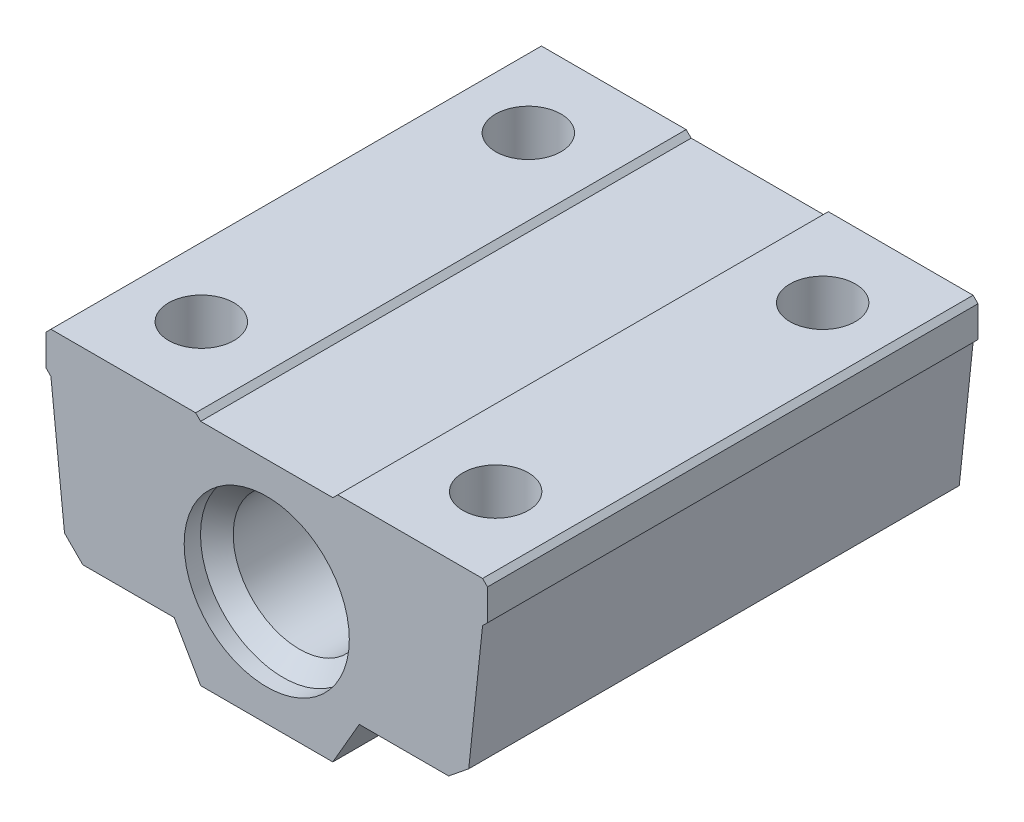
from build123d import *
from OCP.BRepFilletAPI import BRepFilletAPI_MakeChamfer

# Parameters (mm, degrees)
BOSS_EXTRUDE1_DEPTH     = 15
BOSS_EXTRUDE2_DEPTH     = 15
CHAMFER1_SIZE           = 0.3
CHAMFER1_SIZE_2         = 0.303787717
CUT_EXTRUDE1_DEPTH      = 22.460195712
CUT_EXTRUDE1_DEPTH_BACK = 22.460195712
CHAMFER2_SIZE           = 0.3
CHAMFER3_SIZE           = 1
CHAMFER3_SIZE2          = 1.124223602
CUT_EXTRUDE2_DEPTH      = 22.460195712
CUT_EXTRUDE2_DEPTH_BACK = 22.460195712
SKETCH3_R               = 5.05
SKETCH6_R               = 5.05
BOSS_EXTRUDE3_DEPTH     = 14
CUT_EXTRUDE3_DEPTH      = 22.460195712
CUT_EXTRUDE3_DEPTH_BACK = 22.460195712
SKETCH7_R               = 4.05
CHAMFER4_SIZE           = 1
SKETCH8_R               = 2
CUT_EXTRUDE4_DEPTH      = 25.733378257


# Some blends are built 0.0001 mm under size
with BuildPart() as part:
    # Sketch2 → Boss-Extrude1 (new, symmetric)
    with BuildSketch(Plane.XY):
        Polygon((4.041451884, -7), (8.082903769, 0), (4.041451884, 7), (-4.041451884, 7), (-8.082903769, 0), (-4.041451884, -7), align=None)
    extrude(amount=BOSS_EXTRUDE1_DEPTH, both=True)

    # Sketch4 → Boss-Extrude2 (add, symmetric)
    with BuildSketch(Plane.XY):
        Polygon((5.658032638, -4.2), (13.5, -4.2), (13.5, 7.3), (4.045169627, 7.3), (4.041451884, 7), (-4.041451884, 7), (-4.045169627, 7.3), (-13.5, 7.3), (-13.5, -4.2), (-5.658032638, -4.2), (-4.041451884, -7), (4.041451884, -7), align=None)
    extrude(amount=BOSS_EXTRUDE2_DEPTH, both=True)

    # Chamfer1
    # the kernel refuses this chamfer: 0.303787717, 0.3 mm, written as the material it adds along each edge
    # the kernel refuses this chamfer: 0.303787717, 0.3 mm, written as the material it takes off along each edge
    with BuildSketch(Plane(origin=(13.5, 7.3, -15.771504896), x_dir=(0.027495876610584384, -0.9996219169112968, 0), z_dir=(0, 0, 1))) as chamfer1_2_piece_1:
        Polygon((CHAMFER1_SIZE * 0.999621916911, -CHAMFER1_SIZE * 0.0274958766106), (-CHAMFER1_SIZE * 0.0274958766106, -CHAMFER1_SIZE * 0.999621916911), (0, 0), align=None)
    extrude(amount=31.543009793, mode=Mode.SUBTRACT)
    with BuildSketch(Plane(origin=(-13.5, 7.3, -15.771504896), x_dir=(-0.027495876610584464, -0.9996219169112968, 0), z_dir=(0, 0, 1))) as chamfer1_2_piece_2:
        Polygon((CHAMFER1_SIZE * 0.999621916911, CHAMFER1_SIZE * 0.0274958766106), (-CHAMFER1_SIZE * 0.0274958766106, CHAMFER1_SIZE * 0.999621916911), (0, 0), align=None)
    extrude(amount=31.543009793, mode=Mode.SUBTRACT)
    with BuildSketch(Plane(origin=(4.045169627, 7.3, -15.78150282), x_dir=(-0.039528988982007254, -0.9992184240845743, 0), z_dir=(0, 0, 1))) as chamfer1_2_piece_3_section:
        Polygon((CHAMFER1_SIZE_2 * 0.999631529085, CHAMFER1_SIZE_2 * 0.0271441162549), (-CHAMFER1_SIZE * 0.039528988982, CHAMFER1_SIZE * 0.999218424085), (0, 0), align=None)
    chamfer1_2_piece_3 = extrude(amount=31.56300564, mode=Mode.PRIVATE)
    chamfer1_2_piece_3 = split(chamfer1_2_piece_3, bisect_by=Plane(origin=(4.143930379, 7, 0), z_dir=(0, 1, 0)), keep=Keep.TOP, mode=Mode.PRIVATE)
    add(chamfer1_2_piece_3, mode=Mode.SUBTRACT)
    with BuildSketch(Plane(origin=(-4.045169627, 7.3, -15.78150282), x_dir=(0.04021769089274653, -0.9991909413817038, 0), z_dir=(0, 0, 1))) as chamfer1_2_piece_4:
        Polygon((CHAMFER1_SIZE * 0.999612584063, -CHAMFER1_SIZE * 0.027833105882), (-CHAMFER1_SIZE_2 * 0.0402176908322, -CHAMFER1_SIZE_2 * 0.999190939877), (0, 0), align=None)
    extrude(amount=31.56300564, mode=Mode.SUBTRACT)

    # Sketch5 → Cut-Extrude1 (cut, two sides: drawn at the far end of the back side and taken through both)
    with BuildSketch(Plane.XY.offset(-CUT_EXTRUDE1_DEPTH_BACK)):
        Polygon((12.25, -4.2), (13.5, -4.2), (13.5, 4.8), (13.2, 4.8), align=None)
        Polygon((-13.2, 4.8), (-12.25, -4.2), (-13.5, -4.2), (-13.5, 4.8), align=None)
    extrude(amount=CUT_EXTRUDE1_DEPTH + CUT_EXTRUDE1_DEPTH_BACK, mode=Mode.SUBTRACT)

    # Chamfer2
    chamfer2_edges = [part.edges().sort_by_distance(p)[0] for p in [
        (-13.5, 4.8, 0),
        (13.5, 4.8, 0),
    ]]
    chamfer(chamfer2_edges, length=CHAMFER2_SIZE - 0.0001)  # a hair under: the kernel refuses the full size

    # Chamfer3: one chamfer whose edges measure the first distance from different faces: ONE call of the kernel's chamfer builder (chamfer() names one face for all edges)
    chamfer3_edges_1 = [part.edges().sort_by_distance(p)[0] for p in [
        (-12.25, -4.2, 0),
    ]]
    chamfer3_side_1 = [part.faces().sort_by_distance(p)[0] for p in [
        (-8.954016319, -4.2, 0),
    ]]
    chamfer3_edges_2 = [part.edges().sort_by_distance(p)[0] for p in [
        (12.25, -4.2, 0),
    ]]
    chamfer3_side_2 = [part.faces().sort_by_distance(p)[0] for p in [
        (12.725, 0.3, 0),
    ]]
    chamfer3 = BRepFilletAPI_MakeChamfer(part.part.solid().wrapped)
    for e in chamfer3_edges_1:
        chamfer3.Add(CHAMFER3_SIZE, CHAMFER3_SIZE2, e.wrapped, chamfer3_side_1[0].wrapped)  # the first distance lies on this face
    for e in chamfer3_edges_2:
        chamfer3.Add(CHAMFER3_SIZE, CHAMFER3_SIZE2, e.wrapped, chamfer3_side_2[0].wrapped)  # the first distance lies on this face
    add(Compound.cast(chamfer3.Shape()), mode=Mode.REPLACE)

    # Sketch3 → Cut-Extrude2 (cut, two sides: drawn at the far end of the back side and taken through both)
    with BuildSketch(Plane.XY.offset(-CUT_EXTRUDE2_DEPTH_BACK)):
        Circle(SKETCH3_R)
    extrude(amount=CUT_EXTRUDE2_DEPTH + CUT_EXTRUDE2_DEPTH_BACK, mode=Mode.SUBTRACT)

    # Sketch8 → Cut-Extrude4 (cut, through all)
    with BuildSketch(Plane(origin=(0, 7.3, 0), x_dir=(1, 0, 0), z_dir=(0, 1, 0))):
        with Locations(Location((-9, 10, 0), (0, 0, 180))):
            Circle(SKETCH8_R)
        with Locations(Location((9, 10, 0), (0, 0, 180))):
            Circle(SKETCH8_R)
        with Locations(Location((9, -10, 0), (0, 0, 180))):
            Circle(SKETCH8_R)
        with Locations(Location((-9, -10, 0), (0, 0, 180))):
            Circle(SKETCH8_R)
    extrude(amount=-CUT_EXTRUDE4_DEPTH, mode=Mode.SUBTRACT)


with BuildPart() as body_2:
    # Sketch6 → Boss-Extrude3 (new, symmetric)
    with BuildSketch(Plane.XY):
        Circle(SKETCH6_R)
    extrude(amount=BOSS_EXTRUDE3_DEPTH, both=True)

    # Sketch7 → Cut-Extrude3 (cut, two sides: drawn at the far end of the back side and taken through both)
    with BuildSketch(Plane.XY.offset(-CUT_EXTRUDE3_DEPTH_BACK)):
        Circle(SKETCH7_R)
    extrude(amount=CUT_EXTRUDE3_DEPTH + CUT_EXTRUDE3_DEPTH_BACK, mode=Mode.SUBTRACT)

    # Chamfer4
    chamfer4_edges = [body_2.edges().sort_by_distance(p)[0] for p in [
        (-4.05, 0, 14),
        (-4.05, 0, -14),
    ]]
    chamfer(chamfer4_edges, length=CHAMFER4_SIZE - 0.0001)  # a hair under: the kernel refuses the full size


solid = Compound([part.part, body_2.part])
